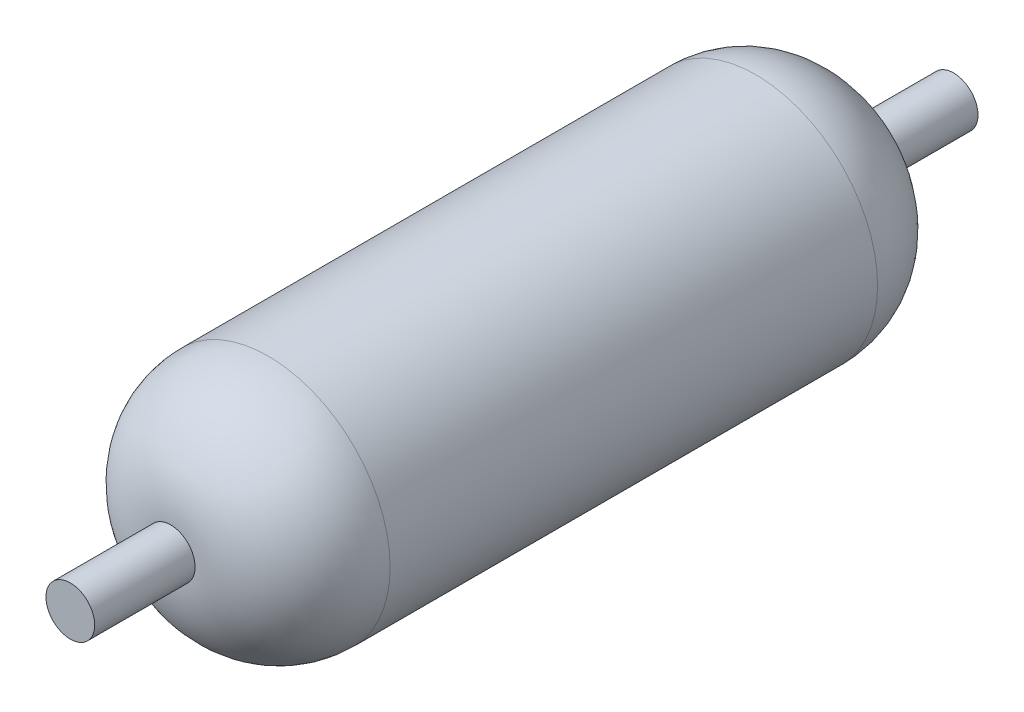
from build123d import *

# Parameters (mm, degrees)
SKETCH1_R           = 1.25
BOSS_EXTRUDE1_DEPTH = 3.5
FILLET1_R           = 1
SKETCH2_R           = 0.25
BOSS_EXTRUDE2_DEPTH = 4.53


with BuildPart() as part:
    # Sketch1 → Boss-Extrude1 (new, symmetric)
    with BuildSketch(Plane.XY):
        Circle(SKETCH1_R)
    extrude(amount=BOSS_EXTRUDE1_DEPTH, both=True)

    # Fillet1
    fillet1_edges = [part.edges().sort_by_distance(p)[0] for p in [
        (-1.25, 0, 3.5),
        (-1.25, 0, -3.5),
    ]]
    fillet(fillet1_edges, radius=FILLET1_R)


with BuildPart() as body_2:
    # Sketch2 → Boss-Extrude2 (new, symmetric)
    with BuildSketch(Plane.XY):
        Circle(SKETCH2_R)
    extrude(amount=BOSS_EXTRUDE2_DEPTH, both=True)


solid = Compound([part.part, body_2.part])
